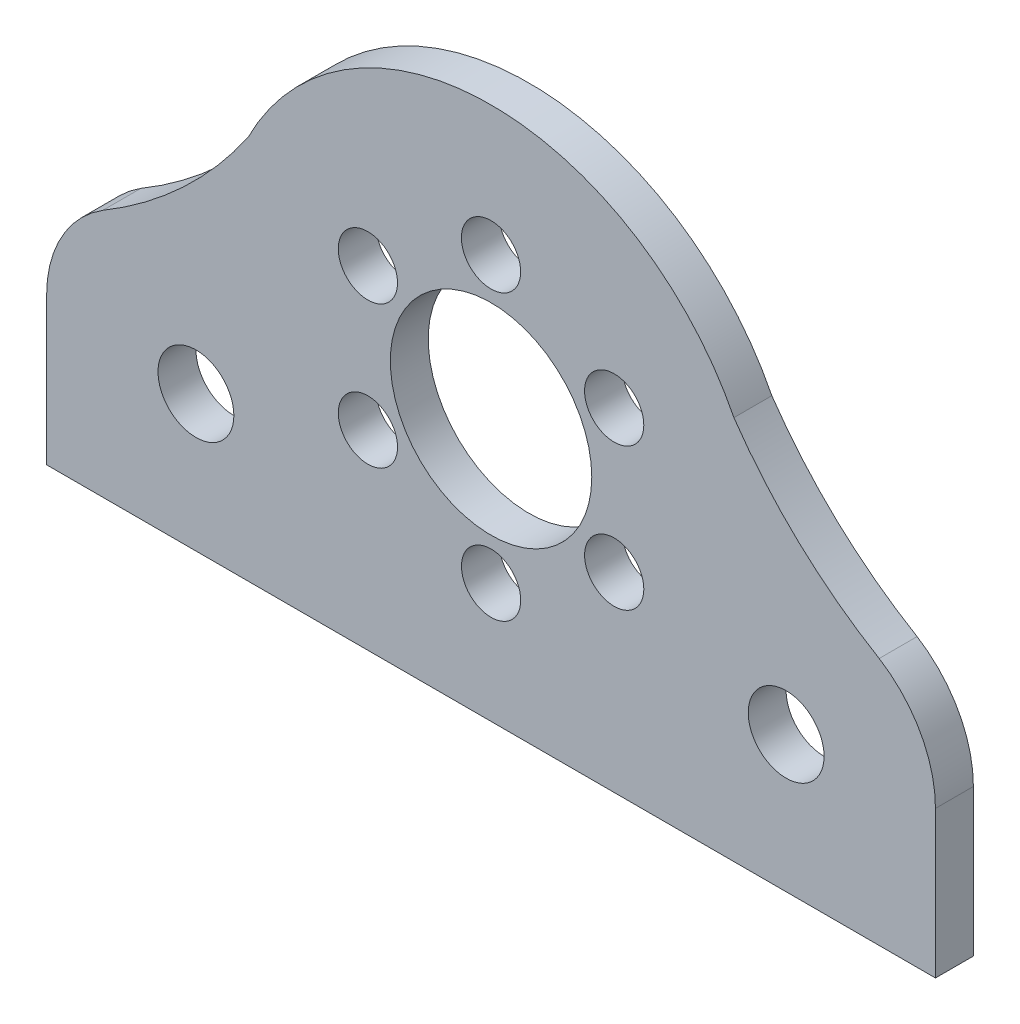
from build123d import *

# Parameters (mm, degrees)
CROQUIS1_R              = 1.6
CROQUIS1_R_2            = 1.25
CROQUIS1_R_3            = 4.25
CROQUIS1_R_4            = 1.250000007
CROQUIS1_R_5            = 1.249999997
SALIENTE_EXTRUIR1_DEPTH = 1.6


with BuildPart() as part:
    # Croquis1 → Saliente-Extruir1 (new body)
    with BuildSketch(Plane.XY):
        with BuildLine():
            Line((-18.75, -4.852747113), (-18.75, -11.05))
            Line((-18.75, -11.05), (18.75, -11.05))
            Line((18.75, -11.05), (18.75, -4.852747113))
            ThreePointArc((18.75, -4.852747113), (18.116780108, -2.400965101), (16.375506293, -0.562441789))
            ThreePointArc((16.375506293, -0.562441789), (12.997975085, 1.970224072), (10.247264226, 5.172676757))
            ThreePointArc((10.247264226, 5.172676757), (0, 11.478806947), (-10.247264226, 5.172676757))
            ThreePointArc((-10.247264226, 5.172676757), (-12.997975085, 1.970224072), (-16.375506293, -0.562441789))
            ThreePointArc((-16.375506293, -0.562441789), (-18.116780108, -2.400965101), (-18.75, -4.852747113))
        make_face()
        with Locations((-12.45, -5.3)):
            Circle(CROQUIS1_R, mode=Mode.SUBTRACT)
        with Locations((-5.194513192, -3.00043923)):
            Circle(CROQUIS1_R_2, mode=Mode.SUBTRACT)
        with Locations((0.0012, -5.9988)):
            Circle(CROQUIS1_R_2, mode=Mode.SUBTRACT)
        with Locations((5.195713192, -2.998360769)):
            Circle(CROQUIS1_R_2, mode=Mode.SUBTRACT)
        Circle(CROQUIS1_R_3, mode=Mode.SUBTRACT)
        with Locations((12.45, -5.3)):
            Circle(CROQUIS1_R, mode=Mode.SUBTRACT)
        with Locations((-5.195713248, 2.998360802)):
            Circle(CROQUIS1_R_4, mode=Mode.SUBTRACT)
        with Locations((-0.0012, 5.99880001)):
            Circle(CROQUIS1_R_5, mode=Mode.SUBTRACT)
        with Locations((5.194513192, 3.000439231)):
            Circle(CROQUIS1_R_2, mode=Mode.SUBTRACT)
    extrude(amount=SALIENTE_EXTRUIR1_DEPTH)


solid = part.part
